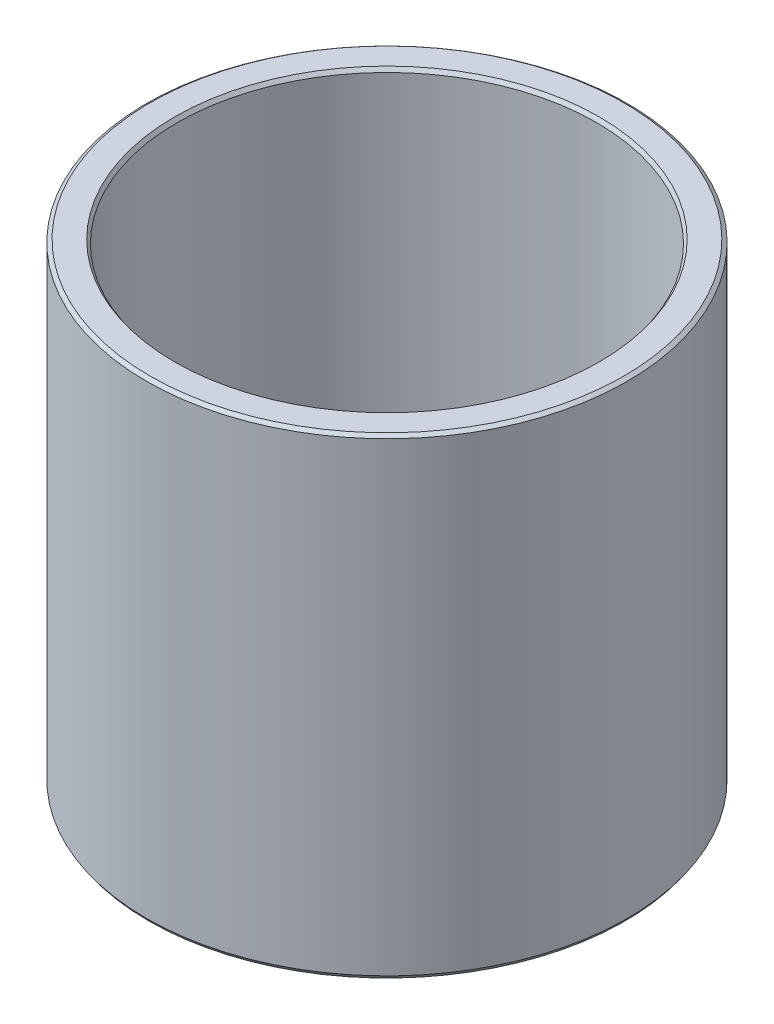
from build123d import *
from OCP.BRepFilletAPI import BRepFilletAPI_MakeChamfer

# Parameters (mm, degrees)
SKETCH1_R           = 55
BOSS_EXTRUDE1_DEPTH = 107.806731483
SKETCH2_R           = 47.954148135
CUT_EXTRUDE1_DEPTH  = 133.937170698
CHAMFER1_SIZE       = 0.590965349
CHAMFER1_SIZE2      = 0.84590058


with BuildPart() as part:
    # Sketch1 → Boss-Extrude1 (new body)
    with BuildSketch(Plane(origin=(0, 0, 0), x_dir=(1, 0, 0), z_dir=(0, 1, 0))):
        Circle(SKETCH1_R)
    extrude(amount=BOSS_EXTRUDE1_DEPTH)

    # Sketch2 → Cut-Extrude1 (cut, through all)
    with BuildSketch(Plane(origin=(0, 0, 0), x_dir=(1, 0, 0), z_dir=(0, 1, 0))):
        Circle(SKETCH2_R)
    extrude(amount=CUT_EXTRUDE1_DEPTH, mode=Mode.SUBTRACT)

    # Chamfer1: one chamfer whose edges measure the first distance from different faces: ONE call of the kernel's chamfer builder (chamfer() names one face for all edges)
    chamfer1_edges_1 = [part.edges().sort_by_distance(p)[0] for p in [
        (-47.954148135, 107.806731483, 0),
    ]]
    chamfer1_side_1 = [part.faces().sort_by_distance(p)[0] for p in [
        (-53.444365081, 107.806731483, 0),
    ]]
    chamfer1_edges_2 = [part.edges().sort_by_distance(p)[0] for p in [
        (-47.954148135, 0, 0),
    ]]
    chamfer1_side_2 = [part.faces().sort_by_distance(p)[0] for p in [
        (-47.954148135, 53.903365742, 0),
    ]]
    chamfer1_edges_3 = [part.edges().sort_by_distance(p)[0] for p in [
        (-55, 0, 0),
    ]]
    chamfer1_side_3 = [part.faces().sort_by_distance(p)[0] for p in [
        (-53.444365081, 0, 0),
    ]]
    chamfer1_edges_4 = [part.edges().sort_by_distance(p)[0] for p in [
        (-55, 107.806731483, 0),
    ]]
    chamfer1_side_4 = [part.faces().sort_by_distance(p)[0] for p in [
        (-55, 53.903365742, 0),
    ]]
    chamfer1 = BRepFilletAPI_MakeChamfer(part.part.solid().wrapped)
    for e in chamfer1_edges_1:
        chamfer1.Add(CHAMFER1_SIZE, CHAMFER1_SIZE2, e.wrapped, chamfer1_side_1[0].wrapped)  # the first distance lies on this face
    for e in chamfer1_edges_2:
        chamfer1.Add(CHAMFER1_SIZE, CHAMFER1_SIZE2, e.wrapped, chamfer1_side_2[0].wrapped)  # the first distance lies on this face
    for e in chamfer1_edges_3:
        chamfer1.Add(CHAMFER1_SIZE, CHAMFER1_SIZE2, e.wrapped, chamfer1_side_3[0].wrapped)  # the first distance lies on this face
    for e in chamfer1_edges_4:
        chamfer1.Add(CHAMFER1_SIZE, CHAMFER1_SIZE2, e.wrapped, chamfer1_side_4[0].wrapped)  # the first distance lies on this face
    add(Compound.cast(chamfer1.Shape()), mode=Mode.REPLACE)


solid = part.part
